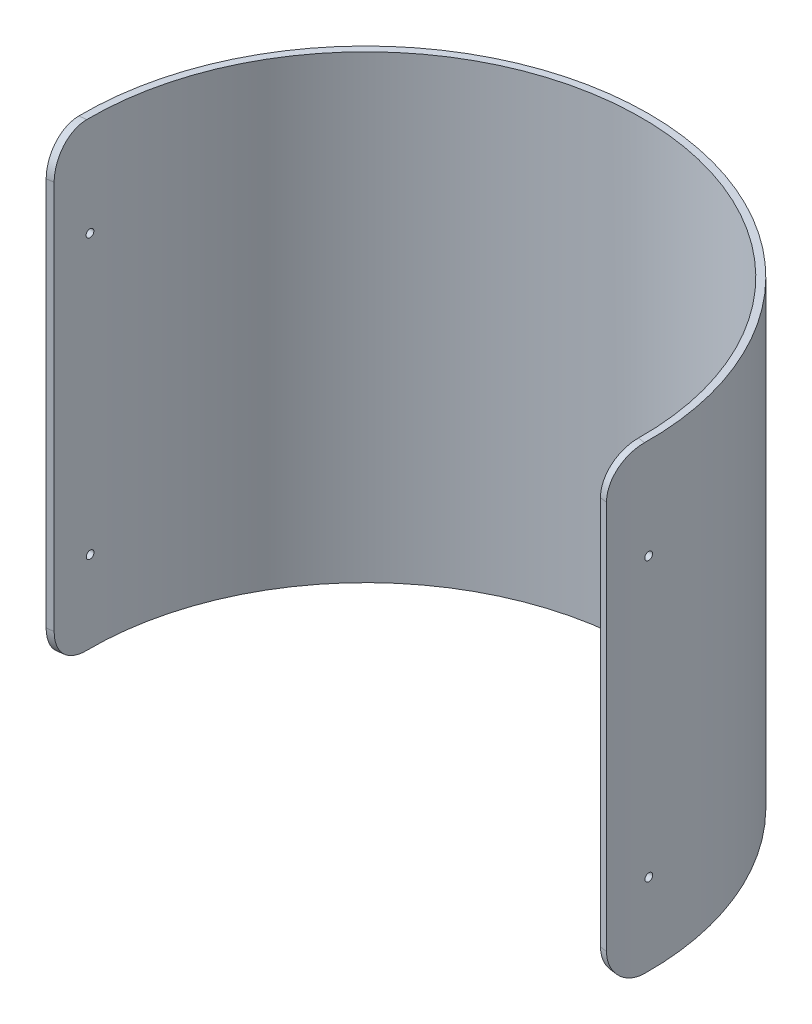
from build123d import *

# Parameters (mm, degrees)
SKETCH1_R               = 101.6
SKETCH1_R_2             = 99.06
BOSS_EXTRUDE1_DEPTH     = 165.1
CUT_EXTRUDE1_DEPTH      = 165.1
FILLET1_R               = 12.7
CUT_EXTRUDE2_DEPTH      = 219.867837001
CUT_EXTRUDE2_DEPTH_BACK = 219.867837001
SKETCH3_R               = 1.397
SKETCH4_R               = 9.525
CUT_EXTRUDE3_DEPTH      = 219.867837002


with BuildPart() as part:
    # Sketch1 → Boss-Extrude1 (new body)
    with BuildSketch(Plane(origin=(0, 0, 0), x_dir=(1, 0, 0), z_dir=(0, 1, 0))):
        Circle(SKETCH1_R)
        Circle(SKETCH1_R_2, mode=Mode.SUBTRACT)
    extrude(amount=BOSS_EXTRUDE1_DEPTH)

    # Sketch2 → Cut-Extrude1 (cut)
    with BuildSketch(Plane(origin=(0, 0, 0), x_dir=(1, 0, 0), z_dir=(0, 1, 0))):
        with BuildLine():
            ThreePointArc((98.09595489, -13.786487381), (0, -99.06), (-98.09595489, -13.786487381))
            Line((-98.09595489, -13.786487381), (-100.611235784, -14.139987058))
            ThreePointArc((-100.611235784, -14.139987058), (0, -101.6), (100.611235784, -14.139987058))
            Line((100.611235784, -14.139987058), (98.09595489, -13.786487381))
        make_face()
    extrude(amount=CUT_EXTRUDE1_DEPTH, mode=Mode.SUBTRACT)

    # Fillet1
    fillet1_edges = [part.edges().sort_by_distance(p)[0] for p in [
        (99.353595337, 0, 13.963237219),
        (99.353595337, 165.1, 13.963237219),
        (-99.353595337, 0, 13.963237219),
        (-99.353595337, 165.1, 13.963237219),
    ]]
    fillet(fillet1_edges, radius=FILLET1_R)

    # Sketch3 → Cut-Extrude2 (cut, two sides: drawn at the far end of the back side and taken through both)
    with BuildSketch(Plane(origin=(0, 0, 0), x_dir=(0, 0, -1), z_dir=(1, 0, 0)).offset(-CUT_EXTRUDE2_DEPTH_BACK)):
        with Locations((0.022897636, 129.159100035)):
            Circle(SKETCH3_R)
        with Locations((0.084012942, 29.1846)):
            Circle(SKETCH3_R)
    extrude(amount=CUT_EXTRUDE2_DEPTH + CUT_EXTRUDE2_DEPTH_BACK, mode=Mode.SUBTRACT)

    # Sketch4 → Cut-Extrude3 (cut, through all)
    with BuildSketch(Plane.XY):
        with Locations((0, 20.32)):
            Circle(SKETCH4_R)
    extrude(amount=-CUT_EXTRUDE3_DEPTH, mode=Mode.SUBTRACT)


solid = part.part
